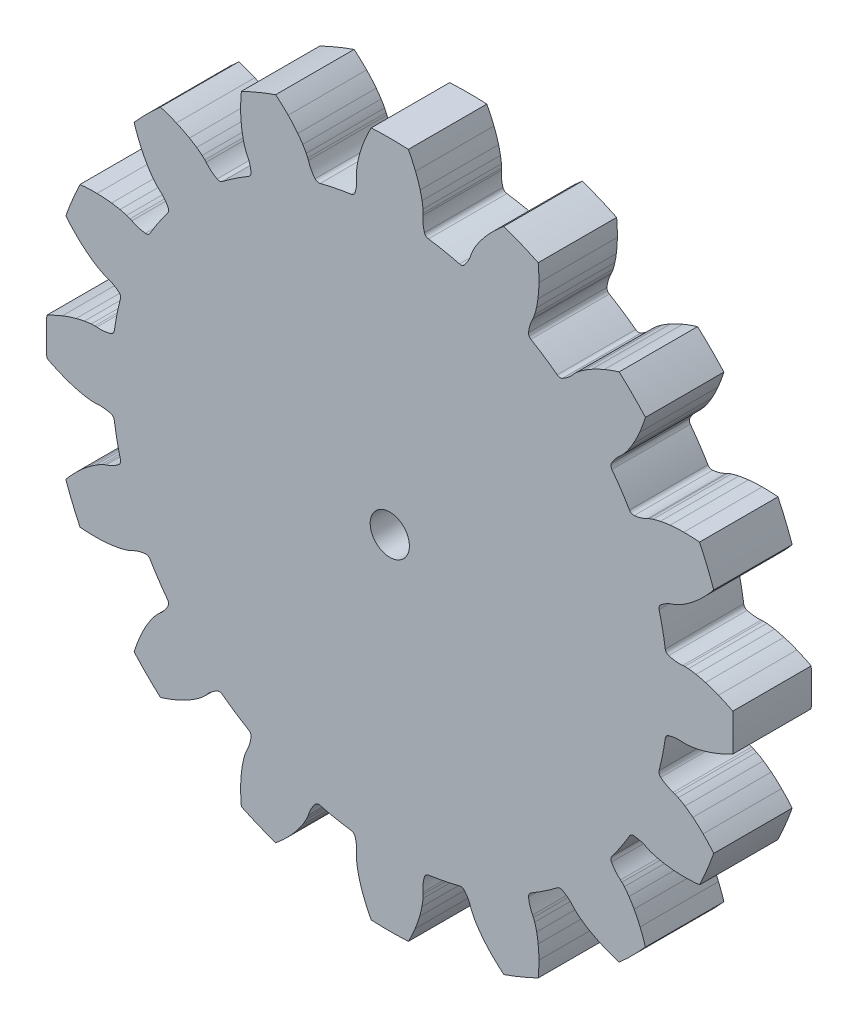
from build123d import *

# Parameters (mm, degrees)
BOSS_EXTRUDE1_DEPTH = 6.35
SKETCH2_R           = 1.5875
CUT_EXTRUDE1_DEPTH  = 40.830678898


with BuildPart() as part:
    # Model → Boss-Extrude1 (new body)
    with BuildSketch(Plane.XY):
        with BuildLine():
            ThreePointArc((22.086724936, -4.393322745), (22.202755532, -3.763289774), (22.300817937, -3.130211256))
            ThreePointArc((22.300817937, -3.130211256), (22.391700215, -2.928061147), (22.576827182, -2.806191293))
            ThreePointArc((22.576827182, -2.806191293), (23.141348869, -2.692426056), (23.717218917, -2.693402016))
            ThreePointArc((23.717218917, -2.693402016), (23.795990351, -2.699103522), (23.874961367, -2.700115778))
            ThreePointArc((23.874961367, -2.700115778), (24.020610065, -2.695308298), (24.166028598, -2.685815903))
            ThreePointArc((24.166028598, -2.685815903), (24.443766141, -2.656087394), (24.719639861, -2.612319628))
            ThreePointArc((24.719639861, -2.612319628), (25.058590913, -2.542497556), (25.39440211, -2.458868748))
            ThreePointArc((25.39440211, -2.458868748), (25.960652326, -2.287370407), (26.515782007, -2.08271942))
            ThreePointArc((26.515782007, -2.08271942), (27.147013649, -1.809737889), (27.763557433, -1.505031367))
            ThreePointArc((27.763557433, -1.505031367), (27.804320541, 0), (27.763557433, 1.505031367))
            ThreePointArc((27.763557433, 1.505031367), (27.192336158, 1.788710415), (26.608421948, 2.045248409))
            ThreePointArc((26.608421948, 2.045248409), (26.087795145, 2.243333519), (25.557268985, 2.413133319))
            ThreePointArc((25.557268985, 2.413133319), (25.175253154, 2.514973473), (24.789072057, 2.599659205))
            ThreePointArc((24.789072057, 2.599659205), (24.478759923, 2.6514833), (24.166028997, 2.68581587))
            ThreePointArc((24.166028997, 2.68581587), (24.020610388, 2.695308282), (23.874961613, 2.700115775))
            ThreePointArc((23.874961613, 2.700115775), (23.79599049, 2.699103524), (23.71721895, 2.693402019))
            ThreePointArc((23.71721895, 2.693402019), (23.141348906, 2.692426051), (22.576827219, 2.806191272))
            ThreePointArc((22.576827219, 2.806191272), (22.391700244, 2.928061115), (22.300817942, 3.130211215))
            ThreePointArc((22.300817942, 3.130211215), (22.08672494, 4.393322725), (21.801149238, 5.64221544))
            ThreePointArc((21.801149238, 5.64221544), (21.807754017, 5.863756931), (21.932151458, 6.047195017))
            ThreePointArc((21.932151458, 6.047195017), (22.410165419, 6.368333489), (22.942573453, 6.587807746))
            ThreePointArc((22.942573453, 6.587807746), (23.017530641, 6.612684764), (23.09087772, 6.641970461))
            ThreePointArc((23.09087772, 6.641970461), (23.223599828, 6.702149337), (23.354316452, 6.76656843))
            ThreePointArc((23.354316452, 6.76656843), (23.599535876, 6.900319547), (23.83766076, 7.046327993))
            ThreePointArc((23.83766076, 7.046327993), (24.12409095, 7.240546128), (24.402336682, 7.446318452))
            ThreePointArc((24.402336682, 7.446318452), (24.859854093, 7.821456836), (25.294410501, 8.222968626))
            ThreePointArc((25.294410501, 8.222968626), (25.773126986, 8.716732567), (26.226133031, 9.234185777))
            ThreePointArc((26.226133031, 9.234185777), (25.687842663, 10.640252819), (25.074231893, 12.015121129))
            ThreePointArc((25.074231893, 12.015121129), (24.437932976, 12.058609477), (23.800293749, 12.072165385))
            ThreePointArc((23.800293749, 12.072165385), (23.243493412, 12.055936912), (22.688371581, 12.0097879))
            ThreePointArc((22.688371581, 12.0097879), (22.296462434, 11.957684804), (21.907269796, 11.888139111))
            ThreePointArc((21.907269796, 11.888139111), (21.600746544, 11.817267019), (21.298682337, 11.729309234))
            ThreePointArc((21.298682337, 11.729309234), (21.160700471, 11.682429787), (21.024298801, 11.631133957))
            ThreePointArc((21.024298801, 11.631133957), (20.951726369, 11.599977819), (20.881132826, 11.564565752))
            ThreePointArc((20.881132826, 11.564565752), (20.349471766, 11.34328815), (19.784385669, 11.232360413))
            ThreePointArc((19.784385669, 11.232360413), (19.566713076, 11.27410844), (19.405389283, 11.426091629))
            ThreePointArc((19.405389283, 11.426091629), (18.724221293, 12.511124655), (17.982453195, 13.555665983))
            ThreePointArc((17.982453195, 13.555665983), (17.903774957, 13.762871171), (17.948504491, 13.979950705))
            ThreePointArc((17.948504491, 13.979950705), (18.267237433, 14.459571989), (18.675129157, 14.866083497))
            ThreePointArc((18.675129157, 14.866083497), (18.734860545, 14.917751739), (18.791417259, 14.972876907))
            ThreePointArc((18.791417259, 14.972876907), (18.89100704, 15.079265491), (18.987121334, 15.188804058))
            ThreePointArc((18.987121334, 15.188804058), (19.162490204, 15.406215388), (19.326613898, 15.632236051))
            ThreePointArc((19.326613898, 15.632236051), (19.516916824, 15.921282299), (19.695236702, 16.21787117))
            ThreePointArc((19.695236702, 16.21787117), (19.97436843, 16.739538178), (20.222194291, 17.27678424))
            ThreePointArc((20.222194291, 17.27678424), (20.475515373, 17.916159507), (20.696017616, 18.567581845))
            ThreePointArc((20.696017616, 18.567581845), (19.660623601, 19.660623601), (18.567581845, 20.696017616))
            ThreePointArc((18.567581845, 20.696017616), (17.96307603, 20.492694557), (17.368786577, 20.261204615))
            ThreePointArc((17.368786577, 20.261204615), (16.860580509, 20.033133198), (16.365375275, 19.778061142))
            ThreePointArc((16.365375275, 19.778061142), (16.023237426, 19.57994702), (15.690284298, 19.366757603))
            ThreePointArc((15.690284298, 19.366757603), (15.434215315, 19.183978958), (15.188804364, 18.987121593))
            ThreePointArc((15.188804364, 18.987121593), (15.07926573, 18.891007257), (14.972877082, 18.791417431))
            ThreePointArc((14.972877082, 18.791417431), (14.917751836, 18.734860646), (14.866083518, 18.675129183))
            ThreePointArc((14.866083518, 18.675129183), (14.459572019, 18.267237456), (13.979950747, 17.948504502))
            ThreePointArc((13.979950747, 17.948504502), (13.762871214, 17.903774955), (13.555666016, 17.98245317))
            ThreePointArc((13.555666016, 17.98245317), (12.511124689, 18.72422127), (11.426091665, 19.405389262))
            ThreePointArc((11.426091665, 19.405389262), (11.274108459, 19.566713037), (11.232360418, 19.784385626))
            ThreePointArc((11.232360418, 19.784385626), (11.34328814, 20.34947173), (11.564565736, 20.881132797))
            ThreePointArc((11.564565736, 20.881132797), (11.599977764, 20.951726241), (11.631133866, 21.024298573))
            ThreePointArc((11.631133866, 21.024298573), (11.682429677, 21.160700167), (11.729309111, 21.298681955))
            ThreePointArc((11.729309111, 21.298681955), (11.808129107, 21.566654594), (11.873265265, 21.838277877))
            ThreePointArc((11.873265265, 21.838277877), (11.938469034, 22.178147567), (11.989715472, 22.520400017))
            ThreePointArc((11.989715472, 22.520400017), (12.047966241, 23.109176576), (12.071332314, 23.700366068))
            ThreePointArc((12.071332314, 23.700366068), (12.060692156, 24.388013572), (12.015121129, 25.074231893))
            ThreePointArc((12.015121129, 25.074231893), (10.640252819, 25.687842663), (9.234185777, 26.226133031))
            ThreePointArc((9.234185777, 26.226133031), (8.753503593, 25.806952658), (8.293039097, 25.365659111))
            ThreePointArc((8.293039097, 25.365659111), (7.910797066, 24.960466554), (7.550898935, 24.535303864))
            ThreePointArc((7.550898935, 24.535303864), (7.310619771, 24.221339795), (7.084595249, 23.896962811))
            ThreePointArc((7.084595249, 23.896962811), (6.917964716, 23.630104004), (6.766568613, 23.354316809))
            ThreePointArc((6.766568613, 23.354316809), (6.702149475, 23.223600121), (6.641970558, 23.090877946))
            ThreePointArc((6.641970558, 23.090877946), (6.612684816, 23.017530771), (6.587807755, 22.942573485))
            ThreePointArc((6.587807755, 22.942573485), (6.368333508, 22.410165451), (6.047195052, 21.932151485))
            ThreePointArc((6.047195052, 21.932151485), (5.863756971, 21.807754032), (5.64221548, 21.801149227))
            ThreePointArc((5.64221548, 21.801149227), (4.393322765, 22.086724932), (3.130211256, 22.300817937))
            ThreePointArc((3.130211256, 22.300817937), (2.928061147, 22.391700215), (2.806191293, 22.576827182))
            ThreePointArc((2.806191293, 22.576827182), (2.692426056, 23.141348869), (2.693402016, 23.717218917))
            ThreePointArc((2.693402016, 23.717218917), (2.699103522, 23.795990351), (2.700115778, 23.874961367))
            ThreePointArc((2.700115778, 23.874961367), (2.695308298, 24.020610065), (2.685815903, 24.166028598))
            ThreePointArc((2.685815903, 24.166028598), (2.656087394, 24.443766141), (2.612319628, 24.719639861))
            ThreePointArc((2.612319628, 24.719639861), (2.542497556, 25.058590913), (2.458868748, 25.39440211))
            ThreePointArc((2.458868748, 25.39440211), (2.287370407, 25.960652326), (2.08271942, 26.515782007))
            ThreePointArc((2.08271942, 26.515782007), (1.809737889, 27.147013649), (1.505031367, 27.763557433))
            ThreePointArc((1.505031367, 27.763557433), (0, 27.804320541), (-1.505031367, 27.763557433))
            ThreePointArc((-1.505031367, 27.763557433), (-1.788710415, 27.192336158), (-2.045248409, 26.608421948))
            ThreePointArc((-2.045248409, 26.608421948), (-2.243333519, 26.087795145), (-2.413133319, 25.557268985))
            ThreePointArc((-2.413133319, 25.557268985), (-2.514973473, 25.175253154), (-2.599659205, 24.789072057))
            ThreePointArc((-2.599659205, 24.789072057), (-2.6514833, 24.478759923), (-2.68581587, 24.166028997))
            ThreePointArc((-2.68581587, 24.166028997), (-2.695308282, 24.020610388), (-2.700115775, 23.874961613))
            ThreePointArc((-2.700115775, 23.874961613), (-2.699103524, 23.79599049), (-2.693402019, 23.71721895))
            ThreePointArc((-2.693402019, 23.71721895), (-2.692426051, 23.141348906), (-2.806191272, 22.576827219))
            ThreePointArc((-2.806191272, 22.576827219), (-2.928061115, 22.391700244), (-3.130211215, 22.300817942))
            ThreePointArc((-3.130211215, 22.300817942), (-4.393322725, 22.08672494), (-5.64221544, 21.801149238))
            ThreePointArc((-5.64221544, 21.801149238), (-5.863756931, 21.807754017), (-6.047195017, 21.932151458))
            ThreePointArc((-6.047195017, 21.932151458), (-6.368333489, 22.410165419), (-6.587807746, 22.942573453))
            ThreePointArc((-6.587807746, 22.942573453), (-6.612684764, 23.017530641), (-6.641970461, 23.09087772))
            ThreePointArc((-6.641970461, 23.09087772), (-6.702149337, 23.223599828), (-6.76656843, 23.354316452))
            ThreePointArc((-6.76656843, 23.354316452), (-6.900319547, 23.599535876), (-7.046327993, 23.83766076))
            ThreePointArc((-7.046327993, 23.83766076), (-7.240546128, 24.12409095), (-7.446318452, 24.402336682))
            ThreePointArc((-7.446318452, 24.402336682), (-7.821456836, 24.859854093), (-8.222968626, 25.294410501))
            ThreePointArc((-8.222968626, 25.294410501), (-8.716732567, 25.773126986), (-9.234185777, 26.226133031))
            ThreePointArc((-9.234185777, 26.226133031), (-10.640252819, 25.687842663), (-12.015121129, 25.074231893))
            ThreePointArc((-12.015121129, 25.074231893), (-12.058609477, 24.437932976), (-12.072165385, 23.800293749))
            ThreePointArc((-12.072165385, 23.800293749), (-12.055936912, 23.243493412), (-12.0097879, 22.688371581))
            ThreePointArc((-12.0097879, 22.688371581), (-11.957684804, 22.296462434), (-11.888139111, 21.907269796))
            ThreePointArc((-11.888139111, 21.907269796), (-11.817267019, 21.600746544), (-11.729309234, 21.298682337))
            ThreePointArc((-11.729309234, 21.298682337), (-11.682429787, 21.160700471), (-11.631133957, 21.024298801))
            ThreePointArc((-11.631133957, 21.024298801), (-11.599977819, 20.951726369), (-11.564565752, 20.881132826))
            ThreePointArc((-11.564565752, 20.881132826), (-11.34328815, 20.349471766), (-11.232360413, 19.784385669))
            ThreePointArc((-11.232360413, 19.784385669), (-11.27410844, 19.566713076), (-11.426091629, 19.405389283))
            ThreePointArc((-11.426091629, 19.405389283), (-12.511124655, 18.724221293), (-13.555665983, 17.982453195))
            ThreePointArc((-13.555665983, 17.982453195), (-13.762871171, 17.903774957), (-13.979950705, 17.948504491))
            ThreePointArc((-13.979950705, 17.948504491), (-14.459571989, 18.267237433), (-14.866083497, 18.675129157))
            ThreePointArc((-14.866083497, 18.675129157), (-14.917751739, 18.734860545), (-14.972876907, 18.791417259))
            ThreePointArc((-14.972876907, 18.791417259), (-15.079265491, 18.89100704), (-15.188804058, 18.987121334))
            ThreePointArc((-15.188804058, 18.987121334), (-15.406215388, 19.162490204), (-15.632236051, 19.326613898))
            ThreePointArc((-15.632236051, 19.326613898), (-15.921282299, 19.516916824), (-16.21787117, 19.695236702))
            ThreePointArc((-16.21787117, 19.695236702), (-16.739538178, 19.97436843), (-17.27678424, 20.222194291))
            ThreePointArc((-17.27678424, 20.222194291), (-17.916159507, 20.475515373), (-18.567581845, 20.696017616))
            ThreePointArc((-18.567581845, 20.696017616), (-19.660623601, 19.660623601), (-20.696017616, 18.567581845))
            ThreePointArc((-20.696017616, 18.567581845), (-20.492694557, 17.96307603), (-20.261204615, 17.368786577))
            ThreePointArc((-20.261204615, 17.368786577), (-20.033133198, 16.860580509), (-19.778061142, 16.365375275))
            ThreePointArc((-19.778061142, 16.365375275), (-19.57994702, 16.023237426), (-19.366757603, 15.690284298))
            ThreePointArc((-19.366757603, 15.690284298), (-19.183978958, 15.434215315), (-18.987121593, 15.188804364))
            ThreePointArc((-18.987121593, 15.188804364), (-18.891007257, 15.07926573), (-18.791417431, 14.972877082))
            ThreePointArc((-18.791417431, 14.972877082), (-18.734860646, 14.917751836), (-18.675129183, 14.866083518))
            ThreePointArc((-18.675129183, 14.866083518), (-18.267237456, 14.459572019), (-17.948504502, 13.979950747))
            ThreePointArc((-17.948504502, 13.979950747), (-17.903774955, 13.762871214), (-17.98245317, 13.555666016))
            ThreePointArc((-17.98245317, 13.555666016), (-18.72422127, 12.511124689), (-19.405389262, 11.426091665))
            ThreePointArc((-19.405389262, 11.426091665), (-19.566713037, 11.274108459), (-19.784385626, 11.232360418))
            ThreePointArc((-19.784385626, 11.232360418), (-20.34947173, 11.34328814), (-20.881132797, 11.564565736))
            ThreePointArc((-20.881132797, 11.564565736), (-20.951726241, 11.599977764), (-21.024298573, 11.631133866))
            ThreePointArc((-21.024298573, 11.631133866), (-21.160700167, 11.682429677), (-21.298681955, 11.729309111))
            ThreePointArc((-21.298681955, 11.729309111), (-21.566654594, 11.808129107), (-21.838277877, 11.873265265))
            ThreePointArc((-21.838277877, 11.873265265), (-22.178147567, 11.938469034), (-22.520400017, 11.989715472))
            ThreePointArc((-22.520400017, 11.989715472), (-23.109176576, 12.047966241), (-23.700366068, 12.071332314))
            ThreePointArc((-23.700366068, 12.071332314), (-24.388013572, 12.060692156), (-25.074231893, 12.015121129))
            ThreePointArc((-25.074231893, 12.015121129), (-25.687842663, 10.640252819), (-26.226133031, 9.234185777))
            ThreePointArc((-26.226133031, 9.234185777), (-25.806952658, 8.753503593), (-25.365659111, 8.293039097))
            ThreePointArc((-25.365659111, 8.293039097), (-24.960466554, 7.910797066), (-24.535303864, 7.550898935))
            ThreePointArc((-24.535303864, 7.550898935), (-24.221339795, 7.310619771), (-23.896962811, 7.084595249))
            ThreePointArc((-23.896962811, 7.084595249), (-23.630104004, 6.917964716), (-23.354316809, 6.766568613))
            ThreePointArc((-23.354316809, 6.766568613), (-23.223600121, 6.702149475), (-23.090877946, 6.641970558))
            ThreePointArc((-23.090877946, 6.641970558), (-23.017530771, 6.612684816), (-22.942573485, 6.587807755))
            ThreePointArc((-22.942573485, 6.587807755), (-22.410165451, 6.368333508), (-21.932151485, 6.047195052))
            ThreePointArc((-21.932151485, 6.047195052), (-21.807754032, 5.863756971), (-21.801149227, 5.64221548))
            ThreePointArc((-21.801149227, 5.64221548), (-22.086724932, 4.393322765), (-22.300817937, 3.130211256))
            ThreePointArc((-22.300817937, 3.130211256), (-22.391700215, 2.928061147), (-22.576827182, 2.806191293))
            ThreePointArc((-22.576827182, 2.806191293), (-23.141348869, 2.692426056), (-23.717218917, 2.693402016))
            ThreePointArc((-23.717218917, 2.693402016), (-23.795990351, 2.699103522), (-23.874961367, 2.700115778))
            ThreePointArc((-23.874961367, 2.700115778), (-24.020610065, 2.695308298), (-24.166028598, 2.685815903))
            ThreePointArc((-24.166028598, 2.685815903), (-24.443766141, 2.656087394), (-24.719639861, 2.612319628))
            ThreePointArc((-24.719639861, 2.612319628), (-25.058590913, 2.542497556), (-25.39440211, 2.458868748))
            ThreePointArc((-25.39440211, 2.458868748), (-25.960652326, 2.287370407), (-26.515782007, 2.08271942))
            ThreePointArc((-26.515782007, 2.08271942), (-27.147013649, 1.809737889), (-27.763557433, 1.505031367))
            ThreePointArc((-27.763557433, 1.505031367), (-27.804320541, 0), (-27.763557433, -1.505031367))
            ThreePointArc((-27.763557433, -1.505031367), (-27.192336158, -1.788710415), (-26.608421948, -2.045248409))
            ThreePointArc((-26.608421948, -2.045248409), (-26.087795145, -2.243333519), (-25.557268985, -2.413133319))
            ThreePointArc((-25.557268985, -2.413133319), (-25.175253154, -2.514973473), (-24.789072057, -2.599659205))
            ThreePointArc((-24.789072057, -2.599659205), (-24.478759923, -2.6514833), (-24.166028997, -2.68581587))
            ThreePointArc((-24.166028997, -2.68581587), (-24.020610388, -2.695308282), (-23.874961613, -2.700115775))
            ThreePointArc((-23.874961613, -2.700115775), (-23.79599049, -2.699103524), (-23.71721895, -2.693402019))
            ThreePointArc((-23.71721895, -2.693402019), (-23.141348906, -2.692426051), (-22.576827219, -2.806191272))
            ThreePointArc((-22.576827219, -2.806191272), (-22.391700244, -2.928061115), (-22.300817942, -3.130211215))
            ThreePointArc((-22.300817942, -3.130211215), (-22.08672494, -4.393322725), (-21.801149238, -5.64221544))
            ThreePointArc((-21.801149238, -5.64221544), (-21.807754017, -5.863756931), (-21.932151458, -6.047195017))
            ThreePointArc((-21.932151458, -6.047195017), (-22.410165419, -6.368333489), (-22.942573453, -6.587807746))
            ThreePointArc((-22.942573453, -6.587807746), (-23.017530641, -6.612684764), (-23.09087772, -6.641970461))
            ThreePointArc((-23.09087772, -6.641970461), (-23.223599828, -6.702149337), (-23.354316452, -6.76656843))
            ThreePointArc((-23.354316452, -6.76656843), (-23.599535876, -6.900319547), (-23.83766076, -7.046327993))
            ThreePointArc((-23.83766076, -7.046327993), (-24.12409095, -7.240546128), (-24.402336682, -7.446318452))
            ThreePointArc((-24.402336682, -7.446318452), (-24.859854093, -7.821456836), (-25.294410501, -8.222968626))
            ThreePointArc((-25.294410501, -8.222968626), (-25.773126986, -8.716732567), (-26.226133031, -9.234185777))
            ThreePointArc((-26.226133031, -9.234185777), (-25.687842663, -10.640252819), (-25.074231893, -12.015121129))
            ThreePointArc((-25.074231893, -12.015121129), (-24.437932976, -12.058609477), (-23.800293749, -12.072165385))
            ThreePointArc((-23.800293749, -12.072165385), (-23.243493412, -12.055936912), (-22.688371581, -12.0097879))
            ThreePointArc((-22.688371581, -12.0097879), (-22.296462434, -11.957684804), (-21.907269796, -11.888139111))
            ThreePointArc((-21.907269796, -11.888139111), (-21.600746544, -11.817267019), (-21.298682337, -11.729309234))
            ThreePointArc((-21.298682337, -11.729309234), (-21.160700471, -11.682429787), (-21.024298801, -11.631133957))
            ThreePointArc((-21.024298801, -11.631133957), (-20.951726369, -11.599977819), (-20.881132826, -11.564565752))
            ThreePointArc((-20.881132826, -11.564565752), (-20.349471766, -11.34328815), (-19.784385669, -11.232360413))
            ThreePointArc((-19.784385669, -11.232360413), (-19.566713076, -11.27410844), (-19.405389283, -11.426091629))
            ThreePointArc((-19.405389283, -11.426091629), (-18.724221293, -12.511124655), (-17.982453195, -13.555665983))
            ThreePointArc((-17.982453195, -13.555665983), (-17.903774957, -13.762871171), (-17.948504491, -13.979950705))
            ThreePointArc((-17.948504491, -13.979950705), (-18.267237433, -14.459571989), (-18.675129157, -14.866083497))
            ThreePointArc((-18.675129157, -14.866083497), (-18.734860545, -14.917751739), (-18.791417259, -14.972876907))
            ThreePointArc((-18.791417259, -14.972876907), (-18.89100704, -15.079265491), (-18.987121334, -15.188804058))
            ThreePointArc((-18.987121334, -15.188804058), (-19.162490204, -15.406215388), (-19.326613898, -15.632236051))
            ThreePointArc((-19.326613898, -15.632236051), (-19.516916824, -15.921282299), (-19.695236702, -16.21787117))
            ThreePointArc((-19.695236702, -16.21787117), (-19.97436843, -16.739538178), (-20.222194291, -17.27678424))
            ThreePointArc((-20.222194291, -17.27678424), (-20.475515373, -17.916159507), (-20.696017616, -18.567581845))
            ThreePointArc((-20.696017616, -18.567581845), (-19.660623601, -19.660623601), (-18.567581845, -20.696017616))
            ThreePointArc((-18.567581845, -20.696017616), (-17.96307603, -20.492694557), (-17.368786577, -20.261204615))
            ThreePointArc((-17.368786577, -20.261204615), (-16.860580509, -20.033133198), (-16.365375275, -19.778061142))
            ThreePointArc((-16.365375275, -19.778061142), (-16.023237426, -19.57994702), (-15.690284298, -19.366757603))
            ThreePointArc((-15.690284298, -19.366757603), (-15.434215315, -19.183978958), (-15.188804364, -18.987121593))
            ThreePointArc((-15.188804364, -18.987121593), (-15.07926573, -18.891007257), (-14.972877082, -18.791417431))
            ThreePointArc((-14.972877082, -18.791417431), (-14.917751836, -18.734860646), (-14.866083518, -18.675129183))
            ThreePointArc((-14.866083518, -18.675129183), (-14.459572019, -18.267237456), (-13.979950747, -17.948504502))
            ThreePointArc((-13.979950747, -17.948504502), (-13.762871214, -17.903774955), (-13.555666016, -17.98245317))
            ThreePointArc((-13.555666016, -17.98245317), (-12.511124689, -18.72422127), (-11.426091665, -19.405389262))
            ThreePointArc((-11.426091665, -19.405389262), (-11.274108459, -19.566713037), (-11.232360418, -19.784385626))
            ThreePointArc((-11.232360418, -19.784385626), (-11.34328814, -20.34947173), (-11.564565736, -20.881132797))
            ThreePointArc((-11.564565736, -20.881132797), (-11.599977764, -20.951726241), (-11.631133866, -21.024298573))
            ThreePointArc((-11.631133866, -21.024298573), (-11.682429677, -21.160700167), (-11.729309111, -21.298681955))
            ThreePointArc((-11.729309111, -21.298681955), (-11.808129107, -21.566654594), (-11.873265265, -21.838277877))
            ThreePointArc((-11.873265265, -21.838277877), (-11.938469034, -22.178147567), (-11.989715472, -22.520400017))
            ThreePointArc((-11.989715472, -22.520400017), (-12.047966241, -23.109176576), (-12.071332314, -23.700366068))
            ThreePointArc((-12.071332314, -23.700366068), (-12.060692156, -24.388013572), (-12.015121129, -25.074231893))
            ThreePointArc((-12.015121129, -25.074231893), (-10.640252819, -25.687842663), (-9.234185777, -26.226133031))
            ThreePointArc((-9.234185777, -26.226133031), (-8.753503593, -25.806952658), (-8.293039097, -25.365659111))
            ThreePointArc((-8.293039097, -25.365659111), (-7.910797066, -24.960466554), (-7.550898935, -24.535303864))
            ThreePointArc((-7.550898935, -24.535303864), (-7.310619771, -24.221339795), (-7.084595249, -23.896962811))
            ThreePointArc((-7.084595249, -23.896962811), (-6.917964716, -23.630104004), (-6.766568613, -23.354316809))
            ThreePointArc((-6.766568613, -23.354316809), (-6.702149475, -23.223600121), (-6.641970558, -23.090877946))
            ThreePointArc((-6.641970558, -23.090877946), (-6.612684816, -23.017530771), (-6.587807755, -22.942573485))
            ThreePointArc((-6.587807755, -22.942573485), (-6.368333508, -22.410165451), (-6.047195052, -21.932151485))
            ThreePointArc((-6.047195052, -21.932151485), (-5.863756971, -21.807754032), (-5.64221548, -21.801149227))
            ThreePointArc((-5.64221548, -21.801149227), (-4.393322765, -22.086724932), (-3.130211256, -22.300817937))
            ThreePointArc((-3.130211256, -22.300817937), (-2.928061147, -22.391700215), (-2.806191293, -22.576827182))
            ThreePointArc((-2.806191293, -22.576827182), (-2.692426056, -23.141348869), (-2.693402016, -23.717218917))
            ThreePointArc((-2.693402016, -23.717218917), (-2.699103522, -23.795990351), (-2.700115778, -23.874961367))
            ThreePointArc((-2.700115778, -23.874961367), (-2.695308298, -24.020610065), (-2.685815903, -24.166028598))
            ThreePointArc((-2.685815903, -24.166028598), (-2.656087394, -24.443766141), (-2.612319628, -24.719639861))
            ThreePointArc((-2.612319628, -24.719639861), (-2.542497556, -25.058590913), (-2.458868748, -25.39440211))
            ThreePointArc((-2.458868748, -25.39440211), (-2.287370407, -25.960652326), (-2.08271942, -26.515782007))
            ThreePointArc((-2.08271942, -26.515782007), (-1.809737889, -27.147013649), (-1.505031367, -27.763557433))
            ThreePointArc((-1.505031367, -27.763557433), (0, -27.804320541), (1.505031367, -27.763557433))
            ThreePointArc((1.505031367, -27.763557433), (1.788710415, -27.192336158), (2.045248409, -26.608421948))
            ThreePointArc((2.045248409, -26.608421948), (2.243333519, -26.087795145), (2.413133319, -25.557268985))
            ThreePointArc((2.413133319, -25.557268985), (2.514973473, -25.175253154), (2.599659205, -24.789072057))
            ThreePointArc((2.599659205, -24.789072057), (2.6514833, -24.478759923), (2.68581587, -24.166028997))
            ThreePointArc((2.68581587, -24.166028997), (2.695308282, -24.020610388), (2.700115775, -23.874961613))
            ThreePointArc((2.700115775, -23.874961613), (2.699103524, -23.79599049), (2.693402019, -23.71721895))
            ThreePointArc((2.693402019, -23.71721895), (2.692426051, -23.141348906), (2.806191272, -22.576827219))
            ThreePointArc((2.806191272, -22.576827219), (2.928061115, -22.391700244), (3.130211215, -22.300817942))
            ThreePointArc((3.130211215, -22.300817942), (4.393322725, -22.08672494), (5.64221544, -21.801149238))
            ThreePointArc((5.64221544, -21.801149238), (5.863756931, -21.807754017), (6.047195017, -21.932151458))
            ThreePointArc((6.047195017, -21.932151458), (6.368333489, -22.410165419), (6.587807746, -22.942573453))
            ThreePointArc((6.587807746, -22.942573453), (6.612684764, -23.017530641), (6.641970461, -23.09087772))
            ThreePointArc((6.641970461, -23.09087772), (6.702149337, -23.223599828), (6.76656843, -23.354316452))
            ThreePointArc((6.76656843, -23.354316452), (6.900319547, -23.599535876), (7.046327993, -23.83766076))
            ThreePointArc((7.046327993, -23.83766076), (7.240546128, -24.12409095), (7.446318452, -24.402336682))
            ThreePointArc((7.446318452, -24.402336682), (7.821456836, -24.859854093), (8.222968626, -25.294410501))
            ThreePointArc((8.222968626, -25.294410501), (8.716732567, -25.773126986), (9.234185777, -26.226133031))
            ThreePointArc((9.234185777, -26.226133031), (10.640252819, -25.687842663), (12.015121129, -25.074231893))
            ThreePointArc((12.015121129, -25.074231893), (12.058609477, -24.437932976), (12.072165385, -23.800293749))
            ThreePointArc((12.072165385, -23.800293749), (12.055936912, -23.243493412), (12.0097879, -22.688371581))
            ThreePointArc((12.0097879, -22.688371581), (11.957684804, -22.296462434), (11.888139111, -21.907269796))
            ThreePointArc((11.888139111, -21.907269796), (11.817267019, -21.600746544), (11.729309234, -21.298682337))
            ThreePointArc((11.729309234, -21.298682337), (11.682429787, -21.160700471), (11.631133957, -21.024298801))
            ThreePointArc((11.631133957, -21.024298801), (11.599977819, -20.951726369), (11.564565752, -20.881132826))
            ThreePointArc((11.564565752, -20.881132826), (11.34328815, -20.349471766), (11.232360413, -19.784385669))
            ThreePointArc((11.232360413, -19.784385669), (11.27410844, -19.566713076), (11.426091629, -19.405389283))
            ThreePointArc((11.426091629, -19.405389283), (12.511124655, -18.724221293), (13.555665983, -17.982453195))
            ThreePointArc((13.555665983, -17.982453195), (13.762871171, -17.903774957), (13.979950705, -17.948504491))
            ThreePointArc((13.979950705, -17.948504491), (14.459571989, -18.267237433), (14.866083497, -18.675129157))
            ThreePointArc((14.866083497, -18.675129157), (14.917751739, -18.734860545), (14.972876907, -18.791417259))
            ThreePointArc((14.972876907, -18.791417259), (15.079265491, -18.89100704), (15.188804058, -18.987121334))
            ThreePointArc((15.188804058, -18.987121334), (15.406215388, -19.162490204), (15.632236051, -19.326613898))
            ThreePointArc((15.632236051, -19.326613898), (15.921282299, -19.516916824), (16.21787117, -19.695236702))
            ThreePointArc((16.21787117, -19.695236702), (16.739538178, -19.97436843), (17.27678424, -20.222194291))
            ThreePointArc((17.27678424, -20.222194291), (17.916159507, -20.475515373), (18.567581845, -20.696017616))
            ThreePointArc((18.567581845, -20.696017616), (19.660623601, -19.660623601), (20.696017616, -18.567581845))
            ThreePointArc((20.696017616, -18.567581845), (20.492694557, -17.96307603), (20.261204615, -17.368786577))
            ThreePointArc((20.261204615, -17.368786577), (20.033133198, -16.860580509), (19.778061142, -16.365375275))
            ThreePointArc((19.778061142, -16.365375275), (19.57994702, -16.023237426), (19.366757603, -15.690284298))
            ThreePointArc((19.366757603, -15.690284298), (19.183978958, -15.434215315), (18.987121593, -15.188804364))
            ThreePointArc((18.987121593, -15.188804364), (18.891007257, -15.07926573), (18.791417431, -14.972877082))
            ThreePointArc((18.791417431, -14.972877082), (18.734860646, -14.917751836), (18.675129183, -14.866083518))
            ThreePointArc((18.675129183, -14.866083518), (18.267237456, -14.459572019), (17.948504502, -13.979950747))
            ThreePointArc((17.948504502, -13.979950747), (17.903774955, -13.762871214), (17.98245317, -13.555666016))
            ThreePointArc((17.98245317, -13.555666016), (18.72422127, -12.511124689), (19.405389262, -11.426091665))
            ThreePointArc((19.405389262, -11.426091665), (19.566713037, -11.274108459), (19.784385626, -11.232360418))
            ThreePointArc((19.784385626, -11.232360418), (20.34947173, -11.34328814), (20.881132797, -11.564565736))
            ThreePointArc((20.881132797, -11.564565736), (20.951726241, -11.599977764), (21.024298573, -11.631133866))
            ThreePointArc((21.024298573, -11.631133866), (21.160700167, -11.682429677), (21.298681955, -11.729309111))
            ThreePointArc((21.298681955, -11.729309111), (21.566654594, -11.808129107), (21.838277877, -11.873265265))
            ThreePointArc((21.838277877, -11.873265265), (22.178147567, -11.938469034), (22.520400017, -11.989715472))
            ThreePointArc((22.520400017, -11.989715472), (23.109176576, -12.047966241), (23.700366068, -12.071332314))
            ThreePointArc((23.700366068, -12.071332314), (24.388013572, -12.060692156), (25.074231893, -12.015121129))
            ThreePointArc((25.074231893, -12.015121129), (25.687842663, -10.640252819), (26.226133031, -9.234185777))
            ThreePointArc((26.226133031, -9.234185777), (25.806952658, -8.753503593), (25.365659111, -8.293039097))
            ThreePointArc((25.365659111, -8.293039097), (24.960466554, -7.910797066), (24.535303864, -7.550898935))
            ThreePointArc((24.535303864, -7.550898935), (24.221339795, -7.310619771), (23.896962811, -7.084595249))
            ThreePointArc((23.896962811, -7.084595249), (23.630104004, -6.917964716), (23.354316809, -6.766568613))
            ThreePointArc((23.354316809, -6.766568613), (23.223600121, -6.702149475), (23.090877946, -6.641970558))
            ThreePointArc((23.090877946, -6.641970558), (23.017530771, -6.612684816), (22.942573485, -6.587807755))
            ThreePointArc((22.942573485, -6.587807755), (22.410165451, -6.368333508), (21.932151485, -6.047195052))
            ThreePointArc((21.932151485, -6.047195052), (21.807754032, -5.863756971), (21.801149227, -5.64221548))
            ThreePointArc((21.801149227, -5.64221548), (21.952820045, -5.019800319), (22.086724936, -4.393322745))
        make_face()
    extrude(amount=BOSS_EXTRUDE1_DEPTH)

    # Sketch2 → Cut-Extrude1 (cut, through all)
    with BuildSketch(Plane.XY.offset(6.35)):
        Circle(SKETCH2_R)
    extrude(amount=-CUT_EXTRUDE1_DEPTH, mode=Mode.SUBTRACT)


solid = part.part
